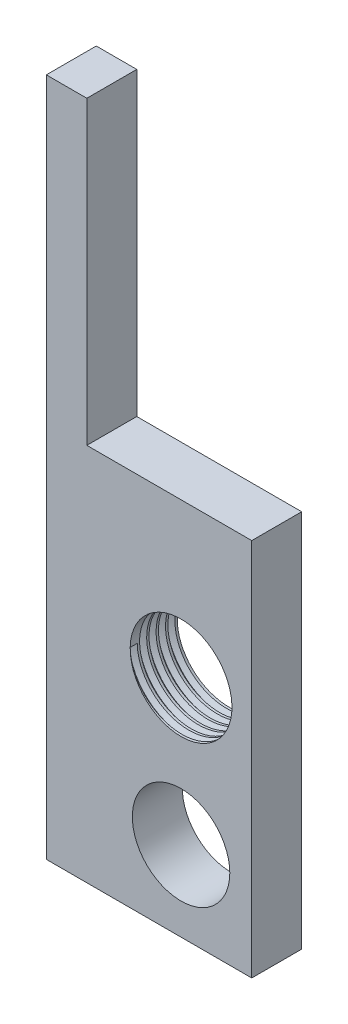
from build123d import *

# Parameters (mm, degrees)
SKETCH1_R           = 5.170974225
SKETCH1_R_2         = 5.4
BOSS_EXTRUDE1_DEPTH = 5.3
THREAD1_PITCH       = 1


with BuildPart() as part:
    # Sketch1 → Boss-Extrude1 (new body)
    with BuildSketch(Plane.XY):
        Polygon((0, 0), (0, 72.1), (4.3, 72.1), (4.3, 40.2), (21.8, 40.2), (21.8, 0), align=None)
        with Locations((14.3, 8.490780261)):
            Circle(SKETCH1_R, mode=Mode.SUBTRACT)
        with Locations((14.3, 23.83765812)):
            Circle(SKETCH1_R_2, mode=Mode.SUBTRACT)
    extrude(amount=BOSS_EXTRUDE1_DEPTH)

    # Thread1: arcs per turn and ends read off the stored shape
    # Thread1: the profile of Thread Profile1 profile screwed along a left-hand helix through 5.3 turns, 8 arcs to a turn; built about Z, then put on its axis
    thread1_z = Axis((0, 0, 0), (0, 0, 1))
    thread1_corners = [(5.3997, 2e-09, -0.000173205), (5.941265875, 3e-09, 0.312499999), (5.941265875, 3e-09, 0.437499999), (5.3997, 2e-09, 0.750173202)]
    with BuildLine(mode=Mode.PRIVATE) as thread1_profile:
        Line(thread1_corners[0], thread1_corners[1])
        Line(thread1_corners[1], thread1_corners[2])
        Line(thread1_corners[2], thread1_corners[3])
        Line(thread1_corners[3], thread1_corners[0])
    thread1_cap = Face(thread1_profile.wire())
    thread1_turn_angles = [0, -22.5, -45, -67.5, -90, -112.5, -135, -157.5, -180, -202.5, -225, -247.5, -270, -292.5, -315, -337.5, -360]
    thread1_turn_weights = [1, 0.9238795325112867, 1, 0.9238795325112867, 1, 0.9238795325112867, 1, 0.9238795325112867, 1, 0.9238795325112867, 1, 0.9238795325112867, 1, 0.9238795325112867, 1, 0.9238795325112867, 1]
    thread1_turn_rails = [Edge.make_bspline([Vector(p[0], p[1], 0).rotate(thread1_z, thread1_turn_angles[k]) / thread1_turn_weights[k] + Vector(0, 0, p[2] + -THREAD1_PITCH * thread1_turn_angles[k] / 360) for k in range(17)], [0, 0, 0, 1, 1, 2, 2, 3, 3, 4, 4, 5, 5, 6, 6, 7, 7, 8, 8, 8], 2, thread1_turn_weights) for p in thread1_corners]
    thread1_turn_sides = [Face.make_surface_from_curves(thread1_turn_rails[p[0]], thread1_turn_rails[p[1]]) for p in [(0, 1), (1, 2), (2, 3), (3, 0)]]
    thread1_last_angles = [-1800, -1822.5, -1845, -1867.5, -1890, -1899, -1908]
    thread1_last_weights = [1, 0.9238795325112867, 1, 0.9238795325112867, 1, 0.9876883405951378, 1]
    thread1_last_rails = [Edge.make_bspline([Vector(p[0], p[1], 0).rotate(thread1_z, thread1_last_angles[k]) / thread1_last_weights[k] + Vector(0, 0, p[2] + -THREAD1_PITCH * thread1_last_angles[k] / 360) for k in range(7)], [0, 0, 0, 1, 1, 2, 2, 3, 3, 3], 2, thread1_last_weights) for p in thread1_corners]
    thread1_last_sides = [Face.make_surface_from_curves(thread1_last_rails[p[0]], thread1_last_rails[p[1]]) for p in [(0, 1), (1, 2), (2, 3), (3, 0)]]
    thread1 = Plane(origin=(14.3, 23.83765812, 5.3), x_dir=(-0.999847695, 0.017452406, 0), z_dir=(0, 0, -1)) * Solid(Shell([*[p.moved(Location((0, 0, THREAD1_PITCH * i))) for i in range(5) for p in thread1_turn_sides], *thread1_last_sides, thread1_cap, thread1_cap.rotate(thread1_z, -1908).moved(Location((0, 0, -THREAD1_PITCH * -1908 / 360)))]))
    add(thread1, mode=Mode.SUBTRACT)


solid = part.part
